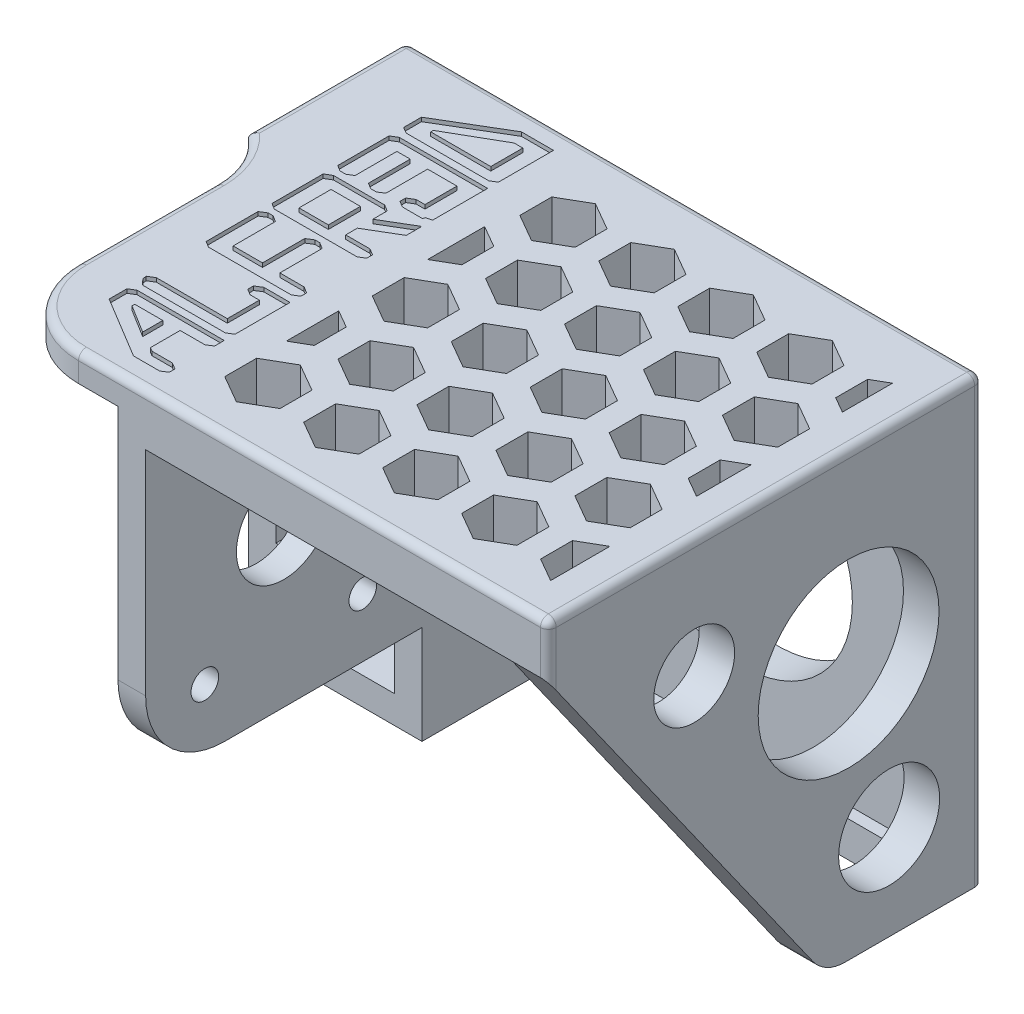
from build123d import *

# Parameters (mm, degrees)
SKETCH1_W           = 15
SKETCH1_H           = 15
BOSS_EXTRUDE2_DEPTH = 20
SKETCH2_W           = 43
SKETCH2_H           = 45
SKETCH2_W_2         = 15
SKETCH2_H_2         = 15
CUT_EXTRUDE1_DEPTH  = 15.5
SKETCH3_R           = 14
SKETCH3_R_2         = 1.75
CUT_EXTRUDE2_DEPTH  = 4.5
BOSS_EXTRUDE3_DEPTH = 35
SKETCH8_R           = 6
SKETCH8_R_2         = 1.75
CUT_EXTRUDE5_DEPTH  = 4
SKETCH9_W           = 43
SKETCH9_H           = 4.5
CUT_EXTRUDE6_DEPTH  = 14
FILLET2_R           = 10
BOSS_EXTRUDE4_DEPTH = 4.5
FILLET3_R           = 10
SKETCH12_W          = 3.5
SKETCH12_H          = 49.5
CUT_EXTRUDE8_DEPTH  = 14
SKETCH13_W          = 3.71830986
SKETCH13_H          = 4.056338029
CUT_EXTRUDE9_DEPTH  = 0.5
CUT_EXTRUDE15_DEPTH = 10
SKETCH15_R          = 11.450905404
SKETCH15_R_2        = 5.123655425
SKETCH15_R_3        = 6.3970329
CUT_EXTRUDE10_DEPTH = 4.5
SKETCH17_W          = 15
SKETCH17_H          = 5.5
CUT_EXTRUDE12_DEPTH = 15.5
FILLET5_R           = 1
FILLET6_R           = 1
FILLET7_R           = 5


with BuildPart() as part:
    # Sketch1 → Boss-Extrude2 (new body)
    with BuildSketch(Plane.XY):
        Polygon((-36.777103754, 43.397171744), (-36.777103754, -12.602828256), (36.222896246, -12.602828256), (36.222896246, 43.397171744), (-14.777103754, 43.397171744), align=None)
        with Locations((-25.777103754, 32.397171744)):
            Rectangle(SKETCH1_W, SKETCH1_H, mode=Mode.SUBTRACT)
    extrude(amount=BOSS_EXTRUDE2_DEPTH)

    # Sketch2 → Cut-Extrude1 (cut)
    with BuildSketch(Plane.XY.offset(20)):
        with Locations((10.222896246, 14.397171744)):
            Rectangle(SKETCH2_W, SKETCH2_H)
        with Locations((-25.777103754, 7.397171744)):
            Rectangle(SKETCH2_W_2, SKETCH2_H_2)
    extrude(amount=-CUT_EXTRUDE1_DEPTH, mode=Mode.SUBTRACT)

    # Sketch3 → Cut-Extrude2 (cut)
    with BuildSketch(Plane.XY.offset(4.5)):
        with Locations((10.222896246, 14.397171744)):
            Circle(SKETCH3_R)
        with Locations((25.722896246, 30.618101976)):
            Circle(SKETCH3_R_2)
        with Locations((-5.277103754, 30.618101976)):
            Circle(SKETCH3_R_2)
        with Locations((-5.277103754, -1.823758489)):
            Circle(SKETCH3_R_2)
        with Locations((25.722896246, -1.823758489)):
            Circle(SKETCH3_R_2)
    extrude(amount=-CUT_EXTRUDE2_DEPTH, mode=Mode.SUBTRACT)

    # Sketch5 → Boss-Extrude3 (add)
    with BuildSketch(Plane.XY.offset(20)):
        Polygon((-33.277103754, 39.897171744), (-33.277103754, 43.397171744), (-18.277103754, 43.397171744), (-14.777103754, 43.397171744), (36.222896246, 43.397171744), (36.222896246, 36.897171744), (-14.777103754, 36.897171744), (-14.777103754, -0.102828256), (-18.277103754, -0.102828256), (-18.277103754, 39.897171744), align=None)
    extrude(amount=BOSS_EXTRUDE3_DEPTH)

    # Sketch8 → Cut-Extrude5 (cut)
    with BuildSketch(Plane.ZY.offset(18.277103754)):
        with Locations((37.5, 19.897171744)):
            Circle(SKETCH8_R)
        with Locations((27.5, 32.397171744)):
            Circle(SKETCH8_R_2)
        with Locations((27.5, 7.397171744)):
            Circle(SKETCH8_R_2)
        with Locations((47.5, 7.397171744)):
            Circle(SKETCH8_R_2)
        with Locations((47.5, 32.397171744)):
            Circle(SKETCH8_R_2)
    extrude(amount=-CUT_EXTRUDE5_DEPTH, mode=Mode.SUBTRACT)

    # Sketch9 → Cut-Extrude6 (cut)
    with BuildSketch(Plane.XY.offset(20)):
        with Locations((10.222896246, -10.352828256)):
            Rectangle(SKETCH9_W, SKETCH9_H)
    extrude(amount=-CUT_EXTRUDE6_DEPTH, mode=Mode.SUBTRACT)

    # Fillet2
    fillet2_edges = [part.edges().sort_by_distance(p)[0] for p in [
        (-16.527103754, -0.102828256, 55),
    ]]
    fillet(fillet2_edges, radius=FILLET2_R)

    # Sketch11 → Boss-Extrude4 (add)
    with BuildSketch(Plane(origin=(36.222896246, 0, 0), x_dir=(0, 0, -1), z_dir=(1, 0, 0))):
        Polygon((-55, 36.897171744), (-20, -12.602828256), (-20, 36.897171744), align=None)
    extrude(amount=-BOSS_EXTRUDE4_DEPTH)

    # Fillet3
    # the kernel refuses this fillet: 10 mm, written as the material it adds along each edge
    with BuildSketch(Plane(origin=(-33.277103754, 39.897171744, 20), x_dir=(0, 0, 1), z_dir=(0, 1, 0))) as fillet3_piece_1:
        with BuildLine():
            CenterArc((7.599342077, -10), FILLET3_R, 90, 49.458398126)
            Line((0, -3.5), (0, 0))
            Line((0, 0), (7.599342077, 0))
        make_face()
    extrude(amount=3.5)
    # the kernel refuses this fillet: 10 mm, written as the material it takes off along each edge
    with BuildSketch(Plane(origin=(-33.277103754, 14.897171744, 55), x_dir=(1, 0, 0), z_dir=(0, 1, 0))) as fillet3_2_piece_1:
        with BuildLine():
            CenterArc((FILLET3_R, FILLET3_R), FILLET3_R, 180, 90)
            Line((0, FILLET3_R), (0, 0))
            Line((0, 0), (FILLET3_R, 0))
        make_face()
    extrude(amount=53.5, mode=Mode.SUBTRACT)

    # Sketch12 → Cut-Extrude8 (cut)
    with BuildSketch(Plane.XY.offset(20)):
        with Locations((-13.027103754, 12.147171744)):
            Rectangle(SKETCH12_W, SKETCH12_H)
    extrude(amount=-CUT_EXTRUDE8_DEPTH, mode=Mode.SUBTRACT)

    # Sketch13 → Cut-Extrude9 (cut)
    # profile 1 of 6: a face of its own
    with BuildSketch(Plane(origin=(0, 43.397171744, 0), x_dir=(1, 0, 0), z_dir=(0, 1, 0))):
        Polygon((-27.277103754, -9.822183099), (-27.277103754, -7.561619718), (-19.338723473, -2.845070423), (-15.277103754, -2.845070423), (-15.277103754, -3.568661972), (-15.277103754, -9.824823944), (-16.04558967, -10.281690141), (-26.505976994, -10.281690141), align=None)
        Polygon((-25.079920656, -8.269366197), (-25.079920656, -8.591549296), (-17.474286853, -8.591549296), (-17.474286853, -4.535211268), (-18.580800937, -4.535211268), align=None, mode=Mode.SUBTRACT)
    # profile 2 of 6: a face of its own
    with BuildSketch(Plane(origin=(0, 43.397171744, 0), x_dir=(1, 0, 0), z_dir=(0, 1, 0))):
        Polygon((-16.06671643, -18.622535211), (-17.305272768, -18.622535211), (-18.641540374, -18.622535211), (-19.407385444, -18.155105634), (-19.407385444, -17.428873239), (-18.594005163, -16.932394366), (-17.474286853, -16.932394366), (-17.474286853, -12.876056338), (-21.192596712, -12.876056338), (-21.192596712, -18.165669014), (-21.929392487, -18.622535211), (-22.647702346, -18.622535211), (-23.389779811, -18.165669014), (-23.389779811, -12.876056338), (-25.079920656, -12.876056338), (-25.079920656, -18.165669014), (-25.81671643, -18.622535211), (-26.537667135, -18.622535211), (-27.277103754, -18.163028169), (-27.277103754, -11.674471831), (-26.455800937, -11.185915493), (-15.277103754, -11.185915493), (-15.277103754, -11.909507042), (-15.277103754, -18.163028169), (-16.021822064, -18.358450704), align=None)
    # profile 3 of 6: a face of its own
    with BuildSketch(Plane(origin=(0, 43.397171744, 0), x_dir=(1, 0, 0), z_dir=(0, 1, 0))):
        Polygon((-27.277103754, -26.503873239), (-27.277103754, -20.015316901), (-26.455800937, -19.526760563), (-19.98308967, -19.526760563), (-19.164427698, -20.012676056), (-19.164427698, -21.8375), (-15.277103754, -19.526760563), (-15.277103754, -21.496830986), (-19.164427698, -23.797007042), (-19.164427698, -25.273239437), (-16.090484036, -25.273239437), (-15.277103754, -25.767077465), (-15.277103754, -26.498591549), (-16.04030798, -26.963380282), (-26.505976994, -26.963380282), align=None)
        with Locations((-23.220765726, -23.245070422)):
            Rectangle(SKETCH13_W, SKETCH13_H, mode=Mode.SUBTRACT)
    # profile 4 of 6: a face of its own
    with BuildSketch(Plane(origin=(0, 43.397171744, 0), x_dir=(1, 0, 0), z_dir=(0, 1, 0))):
        Polygon((-25.864251642, -27.772535211), (-25.079920656, -28.263732394), (-25.079920656, -33.614084507), (-21.361610796, -33.614084507), (-21.361610796, -28.263732394), (-20.577279811, -27.772535211), (-19.948758684, -27.772535211), (-19.164427698, -28.263732394), (-19.164427698, -33.614084507), (-16.090484036, -33.614084507), (-15.277103754, -34.107922535), (-15.277103754, -34.83943662), (-16.04030798, -35.304225352), (-26.508617839, -35.304225352), (-27.277103754, -34.836795775), (-27.277103754, -28.263732394), (-26.492772768, -27.772535211), align=None)
    # profile 5 of 6: a face of its own
    with BuildSketch(Plane(origin=(0, 43.397171744, 0), x_dir=(1, 0, 0), z_dir=(0, 1, 0))):
        Polygon((-27.192596712, -42.913556338), (-27.277103754, -42.451408451), (-26.455800937, -41.954929577), (-17.474286853, -41.954929577), (-17.474286853, -37.898591549), (-18.641540374, -37.898591549), (-19.407385444, -37.431161972), (-19.407385444, -36.704929577), (-18.594005163, -36.208450704), (-15.277103754, -36.208450704), (-15.277103754, -43.188204225), (-16.04558967, -43.645070423), (-26.508617839, -43.645070423), (-27.150343191, -42.9875), align=None)
    # profile 6 of 6: a face of its own
    with BuildSketch(Plane(origin=(0, 43.397171744, 0), x_dir=(1, 0, 0), z_dir=(0, 1, 0))):
        Polygon((-27.10808967, -45.037852113), (-26.299991078, -44.549295775), (-15.277103754, -44.549295775), (-15.277103754, -45.774647887), (-16.04030798, -46.23943662), (-19.164427698, -46.23943662), (-19.164427698, -50.01056338), (-18.68115305, -50.295774648), (-16.090484036, -50.295774648), (-15.277103754, -50.789612676), (-15.277103754, -51.521126761), (-16.032385444, -51.985915493), (-19.325519247, -51.985915493), (-27.10808967, -47.293133803), align=None)
        Polygon((-24.910906571, -46.590669014), (-21.361610796, -48.785211268), (-21.361610796, -46.23943662), (-24.910906571, -46.23943662), align=None, mode=Mode.SUBTRACT)
    extrude(amount=-CUT_EXTRUDE9_DEPTH, mode=Mode.SUBTRACT)

    # Sketch18 → Cut-Extrude15 (cut)
    with BuildSketch(Plane(origin=(0, 43.397171744, 0), x_dir=(1, 0, 0), z_dir=(0, 1, 0))):
        Polygon((-7.777103754, -42.417096231), (-11.277103754, -44.437822174), (-11.277103754, -48.479274058), (-7.777103754, -50.5), (-4.277103754, -48.479274058), (-4.277103754, -44.437822174), align=None)
        Polygon((-2.527103754, -33.323829492), (-6.027103754, -35.344555434), (-6.027103754, -39.386007318), (-2.527103754, -41.40673326), (0.972896246, -39.386007318), (0.972896246, -35.344555434), align=None)
        Polygon((2.722896246, -24.230562752), (-0.777103754, -26.251288694), (-0.777103754, -30.292740578), (2.722896246, -32.313466521), (6.222896246, -30.292740578), (6.222896246, -26.251288694), align=None)
        Polygon((7.972896246, -15.137296012), (4.472896246, -17.158021954), (4.472896246, -21.199473839), (7.972896246, -23.220199781), (11.472896246, -21.199473839), (11.472896246, -17.158021954), align=None)
        Polygon((13.222896246, -6.044029272), (9.722896246, -8.064755215), (9.722896246, -12.106207099), (13.222896246, -14.126933041), (16.722896246, -12.106207099), (16.722896246, -8.064755215), align=None)
        Polygon((2.222896246, -42.417096231), (-1.277103754, -44.437822174), (-1.277103754, -48.479274058), (2.222896246, -50.5), (5.722896246, -48.479274058), (5.722896246, -44.437822174), align=None)
        Polygon((3.972896246, -39.386007318), (7.472896246, -41.40673326), (10.972896246, -39.386007318), (10.972896246, -35.344555434), (7.472896246, -33.323829492), (3.972896246, -35.344555434), align=None)
        Polygon((9.222896246, -26.251288694), (9.222896246, -30.292740578), (12.722896246, -32.313466521), (16.222896246, -30.292740578), (16.222896246, -26.251288694), (12.722896246, -24.230562752), align=None)
        Polygon((14.472896246, -21.199473839), (17.972896246, -23.220199781), (21.472896246, -21.199473839), (21.472896246, -17.158021954), (17.972896246, -15.137296012), (14.472896246, -17.158021954), align=None)
        Polygon((19.722896246, -12.106207099), (23.222896246, -14.126933041), (26.722896246, -12.106207099), (26.722896246, -8.064755215), (23.222896246, -6.044029272), (19.722896246, -8.064755215), align=None)
        Polygon((12.222896246, -42.417096231), (8.722896246, -44.437822174), (8.722896246, -48.479274058), (12.222896246, -50.5), (15.722896246, -48.479274058), (15.722896246, -44.437822174), align=None)
        Polygon((13.972896246, -39.386007318), (17.472896246, -41.40673326), (20.972896246, -39.386007318), (20.972896246, -35.344555434), (17.472896246, -33.323829492), (13.972896246, -35.344555434), align=None)
        Polygon((19.222896246, -26.251288694), (19.222896246, -30.292740578), (22.722896246, -32.313466521), (26.222896246, -30.292740578), (26.222896246, -26.251288694), (22.722896246, -24.230562752), align=None)
        Polygon((24.472896246, -21.199473839), (27.972896246, -23.220199781), (31.472896246, -21.199473839), (31.472896246, -17.158021954), (27.972896246, -15.137296012), (24.472896246, -17.158021954), align=None)
        Polygon((29.722896246, -12.106207099), (31.722896246, -13.260907637), (31.722896246, -6.910054676), (29.722896246, -8.064755215), align=None)
        Polygon((-11.277103754, -15.570308714), (-11.277103754, -22.787187079), (-8.527103754, -21.199473839), (-8.527103754, -17.158021954), align=None)
        Polygon((-11.277103754, -34.045517328), (-11.277103754, -40.685045424), (-9.027103754, -39.386007318), (-9.027103754, -35.344555434), align=None)
        Polygon((31.722896246, -50.211324865), (31.722896246, -42.705771366), (28.722896246, -44.437822174), (28.722896246, -48.479274058), align=None)
        Polygon((22.222896246, -42.417096231), (18.722896246, -44.437822174), (18.722896246, -48.479274058), (22.222896246, -50.5), (25.722896246, -48.479274058), (25.722896246, -44.437822174), align=None)
        Polygon((23.972896246, -39.386007318), (27.472896246, -41.40673326), (30.972896246, -39.386007318), (30.972896246, -35.344555434), (27.472896246, -33.323829492), (23.972896246, -35.344555434), align=None)
        Polygon((29.222896246, -26.251288694), (29.222896246, -30.292740578), (31.722896246, -31.736116251), (31.722896246, -24.807913021), align=None)
        Polygon((-10.777103754, -26.251288694), (-10.777103754, -30.292740578), (-7.277103754, -32.313466521), (-3.777103754, -30.292740578), (-3.777103754, -26.251288694), (-7.277103754, -24.230562752), align=None)
        Polygon((-5.527103754, -21.199473839), (-2.027103754, -23.220199781), (1.472896246, -21.199473839), (1.472896246, -17.158021954), (-2.027103754, -15.137296012), (-5.527103754, -17.158021954), align=None)
        Polygon((-0.277103754, -12.106207099), (3.222896246, -14.126933041), (6.722896246, -12.106207099), (6.722896246, -8.064755215), (3.222896246, -6.044029272), (-0.277103754, -8.064755215), align=None)
        Polygon((-10.277103754, -12.106207099), (-6.777103754, -14.126933041), (-3.277103754, -12.106207099), (-3.277103754, -8.064755215), (-6.777103754, -6.044029272), (-10.277103754, -8.064755215), align=None)
    extrude(amount=-CUT_EXTRUDE15_DEPTH, mode=Mode.SUBTRACT)

    # Sketch15 → Cut-Extrude10 (cut)
    with BuildSketch(Plane(origin=(36.222896246, 0, 0), x_dir=(0, 0, -1), z_dir=(1, 0, 0))):
        with Locations(Location((-16.974429332, 19.922742412, 0), (0, 0, 90))):
            Circle(SKETCH15_R)
        with Locations(Location((-36.531153085, 28.348993954, 0), (0, 0, 90))):
            Circle(SKETCH15_R_2)
        with Locations(Location((-11.841741998, -0.590233797, 0), (0, 0, 90))):
            Circle(SKETCH15_R_3)
    extrude(amount=-CUT_EXTRUDE10_DEPTH, mode=Mode.SUBTRACT)

    # Sketch17 → Cut-Extrude12 (cut)
    with BuildSketch(Plane.XY.offset(20)):
        with Locations((-25.777103754, -6.352828256)):
            Rectangle(SKETCH17_W, SKETCH17_H)
    extrude(amount=-CUT_EXTRUDE12_DEPTH, mode=Mode.SUBTRACT)

    # Fillet5
    fillet5_edges = [part.edges().sort_by_distance(p)[0] for p in [
        (36.222896246, 15.397171744, 0),
        (-0.277103754, 43.397171744, 0),
        (36.222896246, 43.397171744, 27.5),
        (-36.777103754, 43.397171744, 10),
        (-33.277103754, 43.397171744, 36.299671038),
        (-30.348171566, 43.397171744, 52.071067812),
        (-34.194152692, 43.397171744, 23.416041944),
        (6.472896246, 43.397171744, 55),
    ]]
    fillet(fillet5_edges, radius=FILLET5_R)

    # Fillet6
    # the kernel refuses this fillet: 1 mm, written as the material it takes off along each edge
    with BuildSketch(Plane(origin=(35.222896246, 42.397171744, 54), x_dir=(1, 0, 0), z_dir=(0, 0, 1))) as fillet6_piece_1_section:
        Polygon((0, 0), (FILLET6_R, 0), (FILLET6_R, FILLET6_R), (0, FILLET6_R), align=None)
    fillet6_piece_1 = extrude(amount=FILLET6_R, mode=Mode.PRIVATE)
    fillet6_piece_1 = fillet6_piece_1 - Plane(origin=(35.222896246, 42.397171744, 54), x_dir=(-0.7071067811865476, -0.7071067811865475, 0), z_dir=(0, 0, 1)) * Sphere(FILLET6_R, mode=Mode.PRIVATE)
    add(fillet6_piece_1, mode=Mode.SUBTRACT)
    with BuildSketch(Plane(origin=(-35.777103754, 42.397171744, 1), x_dir=(0, 0, -1), z_dir=(-1, 0, 0))) as fillet6_piece_2_section:
        Polygon((0, 0), (FILLET6_R, 0), (FILLET6_R, -FILLET6_R), (0, -FILLET6_R), align=None)
    fillet6_piece_2 = extrude(amount=FILLET6_R, mode=Mode.PRIVATE)
    fillet6_piece_2 = fillet6_piece_2 - Plane(origin=(-35.777103754, 42.397171744, 1), x_dir=(0, -0.7071067811865475, 0.7071067811865475), z_dir=(-1, 0, 0)) * Sphere(FILLET6_R, mode=Mode.PRIVATE)
    add(fillet6_piece_2, mode=Mode.SUBTRACT)
    with BuildSketch(Plane(origin=(-36.777103754, 42.397171744, 0), x_dir=(0, 0, 1), z_dir=(0, -1, 0))) as fillet6_piece_3:
        with BuildLine():
            CenterArc((FILLET6_R, -FILLET6_R), FILLET6_R, 90, 90)
            Line((0, -FILLET6_R), (0, 0))
            Line((0, 0), (FILLET6_R, 0))
        make_face()
    extrude(amount=57.5, mode=Mode.SUBTRACT)
    with BuildSketch(Plane(origin=(36.222896246, 42.397171744, 55), x_dir=(-1, 0, 0), z_dir=(0, -1, 0))) as fillet6_piece_4:
        with BuildLine():
            CenterArc((FILLET6_R, FILLET6_R), FILLET6_R, 180, 90)
            Line((0, FILLET6_R), (0, 0))
            Line((0, 0), (FILLET6_R, 0))
        make_face()
    extrude(amount=8, mode=Mode.SUBTRACT)

    # Fillet7
    fillet7_edges = [part.edges().sort_by_distance(p)[0] for p in [
        (33.972896246, -12.602828256, 20),
    ]]
    fillet(fillet7_edges, radius=FILLET7_R)


solid = part.part
